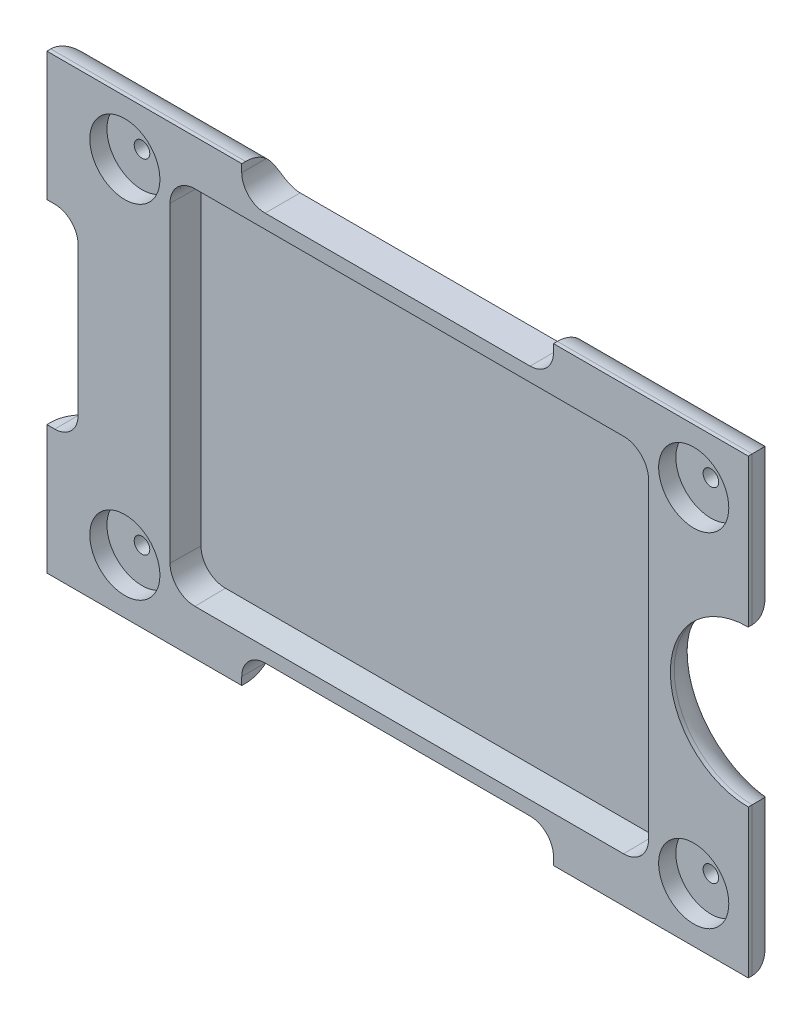
from build123d import *

# Parameters (mm, degrees)
Y_KSEKLIK_EKSTR_ZYON1_DEPTH = 4.5
KES_EKSTR_ZYON2_DEPTH       = 3.9
IZIM7_R                     = 4.5
KES_EKSTR_ZYON3_DEPTH       = 2.2
IZIM9_R                     = 1
KES_EKSTR_ZYON4_DEPTH       = 2
RADYUS4_R                   = 4
PAH1_SIZE                   = 0.2
PAH1_SIZE_2                 = 11.457992326


# Some blends are built 0.0001 mm under size
with BuildPart() as part:
    # Çizim4 → Yükseklik-Ekstrüzyon1 (new body)
    with BuildSketch(Plane.XY):
        with BuildLine():
            Line((200.606144994, -119.46781712), (200.606144994, -100.46781712))
            ThreePointArc((200.606144994, -100.46781712), (190.606144994, -90.46781712), (200.606144994, -80.46781712))
            Line((200.606144994, -80.46781712), (200.606144994, -61.46781712))
            Line((200.606144994, -61.46781712), (175.606144994, -61.46781712))
            Line((175.606144994, -61.46781712), (175.606144994, -62.46781712))
            ThreePointArc((175.606144994, -62.46781712), (174.727465338, -64.589137464), (172.606144994, -65.46781712))
            Line((172.606144994, -65.46781712), (138.606144994, -65.46781712))
            ThreePointArc((138.606144994, -65.46781712), (136.484824651, -64.589137464), (135.606144994, -62.46781712))
            Line((135.606144994, -62.46781712), (135.606144994, -61.46781712))
            Line((135.606144994, -61.46781712), (110.606144994, -61.46781712))
            Line((110.606144994, -61.46781712), (110.606144994, -77.96781712))
            Line((110.606144994, -77.96781712), (111.606144994, -77.96781712))
            ThreePointArc((111.606144994, -77.96781712), (113.727465338, -78.846496777), (114.606144994, -80.96781712))
            Line((114.606144994, -80.96781712), (114.606144994, -99.96781712))
            ThreePointArc((114.606144994, -99.96781712), (113.727465338, -102.089137464), (111.606144994, -102.96781712))
            Line((111.606144994, -102.96781712), (110.606144994, -102.96781712))
            Line((110.606144994, -102.96781712), (110.606144994, -119.46781712))
            Line((110.606144994, -119.46781712), (135.606144994, -119.46781712))
            Line((135.606144994, -119.46781712), (135.606144994, -118.46781712))
            ThreePointArc((135.606144994, -118.46781712), (136.484824651, -116.346496777), (138.606144994, -115.46781712))
            Line((138.606144994, -115.46781712), (172.606144994, -115.46781712))
            ThreePointArc((172.606144994, -115.46781712), (174.727465338, -116.346496777), (175.606144994, -118.46781712))
            Line((175.606144994, -118.46781712), (175.606144994, -119.46781712))
            Line((175.606144994, -119.46781712), (200.606144994, -119.46781712))
        make_face()
    extrude(amount=Y_KSEKLIK_EKSTR_ZYON1_DEPTH)

    # Çizim6 → Kes-Ekstrüzyon2 (cut)
    with BuildSketch(Plane.XY.offset(4.5)):
        with BuildLine():
            Line((129.606144994, -67.46781712), (184.606144994, -67.46781712))
            ThreePointArc((184.606144994, -67.46781712), (186.727465338, -68.346496777), (187.606144994, -70.46781712))
            Line((187.606144994, -70.46781712), (187.606144994, -110.46781712))
            ThreePointArc((187.606144994, -110.46781712), (186.727465338, -112.589137464), (184.606144994, -113.46781712))
            Line((184.606144994, -113.46781712), (129.606144994, -113.46781712))
            ThreePointArc((129.606144994, -113.46781712), (127.484824651, -112.589137464), (126.606144994, -110.46781712))
            Line((126.606144994, -110.46781712), (126.606144994, -70.46781712))
            ThreePointArc((126.606144994, -70.46781712), (127.484824651, -68.346496777), (129.606144994, -67.46781712))
        make_face()
    extrude(amount=-KES_EKSTR_ZYON2_DEPTH, mode=Mode.SUBTRACT)

    # Çizim7 → Kes-Ekstrüzyon3 (cut)
    with BuildSketch(Plane.XY.offset(4.5)):
        with Locations((193.606144994, -68.46781712)):
            Circle(IZIM7_R)
        with Locations((193.606144994, -112.46781712)):
            Circle(IZIM7_R)
        with Locations((120.606144994, -68.46781712)):
            Circle(IZIM7_R)
        with Locations((120.606144994, -112.46781712)):
            Circle(IZIM7_R)
    extrude(amount=-KES_EKSTR_ZYON3_DEPTH, mode=Mode.SUBTRACT)

    # Çizim9 → Kes-Ekstrüzyon4 (cut)
    with BuildSketch(Plane.XY.offset(2.3)):
        with Locations((193.606144994, -68.46781712)):
            Circle(IZIM9_R)
        with Locations((193.606144994, -112.46781712)):
            Circle(IZIM9_R)
        with Locations((120.606144994, -68.46781712)):
            Circle(IZIM9_R)
        with Locations((120.606144994, -112.46781712)):
            Circle(IZIM9_R)
    extrude(amount=-KES_EKSTR_ZYON4_DEPTH, mode=Mode.SUBTRACT)

    # Radyus4
    radyus4_edges = [part.edges().sort_by_distance(p)[0] for p in [
        (123.106144994, -61.46781712, 0),
        (110.606144994, -111.21781712, 0),
        (123.106144994, -119.46781712, 0),
        (188.106144994, -119.46781712, 0),
        (188.106144994, -61.46781712, 0),
        (110.606144994, -69.71781712, 0),
        (200.606144994, -70.96781712, 0),
        (190.606144994, -90.46781712, 0),
        (200.606144994, -109.96781712, 0),
    ]]
    fillet(radyus4_edges, radius=RADYUS4_R - 0.0001)  # a hair under: the kernel refuses the full size

    # Pah1
    # the kernel refuses this chamfer: 11.457992326, 0.2 mm, written as the material it takes off along each edge
    with BuildSketch(Plane(origin=(184.606144994, -70.46781712, 4.5), x_dir=(0, 1, 0), z_dir=(-1, 0, 0))) as pah1_piece_1_section:
        Polygon((3 + PAH1_SIZE, 0), (3, PAH1_SIZE_2), (3, 0), align=None)
    pah1_piece_1 = revolve(axis=Axis((184.606144994, -70.46781712, 4.5), (0, 0, -1)), revolution_arc=90, mode=Mode.PRIVATE)
    pah1_piece_1 = split(pah1_piece_1, bisect_by=Plane(origin=(184.990398639, -67.399868147, 0.6), z_dir=(0, 0, 1)), keep=Keep.TOP, mode=Mode.PRIVATE)
    add(pah1_piece_1, mode=Mode.SUBTRACT)
    with BuildSketch(Plane(origin=(187.606144994, -70.46781712, 4.5), x_dir=(0.41331439412646753, 0, 0.9105883875867686), z_dir=(0, -1, 0))) as pah1_piece_2_section:
        Polygon((PAH1_SIZE * 0.413314394126, -PAH1_SIZE * 0.910588387587), (-PAH1_SIZE_2 * 0.910588387599, -PAH1_SIZE_2 * 0.413314394132), (0, 0), align=None)
    pah1_piece_2 = extrude(amount=40, mode=Mode.PRIVATE)
    pah1_piece_2 = split(pah1_piece_2, bisect_by=Plane(origin=(187.689115858, -74.555184991, 0.6), z_dir=(0, 0, 1)), keep=Keep.TOP, mode=Mode.PRIVATE)
    add(pah1_piece_2, mode=Mode.SUBTRACT)
    with BuildSketch(Plane(origin=(184.606144994, -110.46781712, 4.5), x_dir=(1, 0, 0), z_dir=(0, 1, 0))) as pah1_piece_3_section:
        Polygon((3 + PAH1_SIZE, 0), (3, PAH1_SIZE_2), (3, 0), align=None)
    pah1_piece_3 = revolve(axis=Axis((184.606144994, -110.46781712, 4.5), (0, 0, -1)), revolution_arc=90, mode=Mode.PRIVATE)
    pah1_piece_3 = split(pah1_piece_3, bisect_by=Plane(origin=(187.674093967, -110.852070765, 0.6), z_dir=(0, 0, 1)), keep=Keep.TOP, mode=Mode.PRIVATE)
    add(pah1_piece_3, mode=Mode.SUBTRACT)
    with BuildSketch(Plane(origin=(184.606144994, -113.46781712, 4.5), x_dir=(0, -0.41331439412651433, 0.9105883875867473), z_dir=(-1, 0, 0))) as pah1_piece_4_section:
        Polygon((PAH1_SIZE * 0.413314394127, -PAH1_SIZE * 0.910588387587), (-PAH1_SIZE_2 * 0.910588387599, -PAH1_SIZE_2 * 0.413314394132), (0, 0), align=None)
    pah1_piece_4 = extrude(amount=55, mode=Mode.PRIVATE)
    pah1_piece_4 = split(pah1_piece_4, bisect_by=Plane(origin=(157.106144994, -113.55196189, 0.6), z_dir=(0, 0, 1)), keep=Keep.TOP, mode=Mode.PRIVATE)
    add(pah1_piece_4, mode=Mode.SUBTRACT)
    with BuildSketch(Plane(origin=(129.606144994, -110.46781712, 4.5), x_dir=(0, -1, 0), z_dir=(1, 0, 0))) as pah1_piece_5_section:
        Polygon((3 + PAH1_SIZE, 0), (3, PAH1_SIZE_2), (3, 0), align=None)
    pah1_piece_5 = revolve(axis=Axis((129.606144994, -110.46781712, 4.5), (0, 0, -1)), revolution_arc=90, mode=Mode.PRIVATE)
    pah1_piece_5 = split(pah1_piece_5, bisect_by=Plane(origin=(129.22189135, -113.535766093, 0.6), z_dir=(0, 0, 1)), keep=Keep.TOP, mode=Mode.PRIVATE)
    add(pah1_piece_5, mode=Mode.SUBTRACT)
    with BuildSketch(Plane(origin=(126.606144994, -110.46781712, 4.5), x_dir=(-0.41331439412651433, 0, 0.9105883875867473), z_dir=(0, 1, 0))) as pah1_piece_6_section:
        Polygon((PAH1_SIZE * 0.413314394127, -PAH1_SIZE * 0.910588387587), (-PAH1_SIZE_2 * 0.910588387599, -PAH1_SIZE_2 * 0.413314394132), (0, 0), align=None)
    pah1_piece_6 = extrude(amount=40, mode=Mode.PRIVATE)
    pah1_piece_6 = split(pah1_piece_6, bisect_by=Plane(origin=(126.522000225, -90.46781712, 0.6), z_dir=(0, 0, 1)), keep=Keep.TOP, mode=Mode.PRIVATE)
    add(pah1_piece_6, mode=Mode.SUBTRACT)
    with BuildSketch(Plane(origin=(129.606144994, -70.46781712, 4.5), x_dir=(-1, 0, 0), z_dir=(0, -1, 0))) as pah1_piece_7_section:
        Polygon((3 + PAH1_SIZE, 0), (3, PAH1_SIZE_2), (3, 0), align=None)
    pah1_piece_7 = revolve(axis=Axis((129.606144994, -70.46781712, 4.5), (0, 0, -1)), revolution_arc=90, mode=Mode.PRIVATE)
    pah1_piece_7 = split(pah1_piece_7, bisect_by=Plane(origin=(126.538196021, -70.083563476, 0.6), z_dir=(0, 0, 1)), keep=Keep.TOP, mode=Mode.PRIVATE)
    add(pah1_piece_7, mode=Mode.SUBTRACT)
    with BuildSketch(Plane(origin=(129.606144994, -67.46781712, 4.5), x_dir=(0, 0.41331439412651433, 0.9105883875867473), z_dir=(1, 0, 0))) as pah1_piece_8_section:
        Polygon((PAH1_SIZE * 0.413314394127, -PAH1_SIZE * 0.910588387587), (-PAH1_SIZE_2 * 0.910588387599, -PAH1_SIZE_2 * 0.413314394132), (0, 0), align=None)
    pah1_piece_8 = extrude(amount=55, mode=Mode.PRIVATE)
    pah1_piece_8 = split(pah1_piece_8, bisect_by=Plane(origin=(157.106144994, -67.383672351, 0.6), z_dir=(0, 0, 1)), keep=Keep.TOP, mode=Mode.PRIVATE)
    add(pah1_piece_8, mode=Mode.SUBTRACT)


solid = part.part
